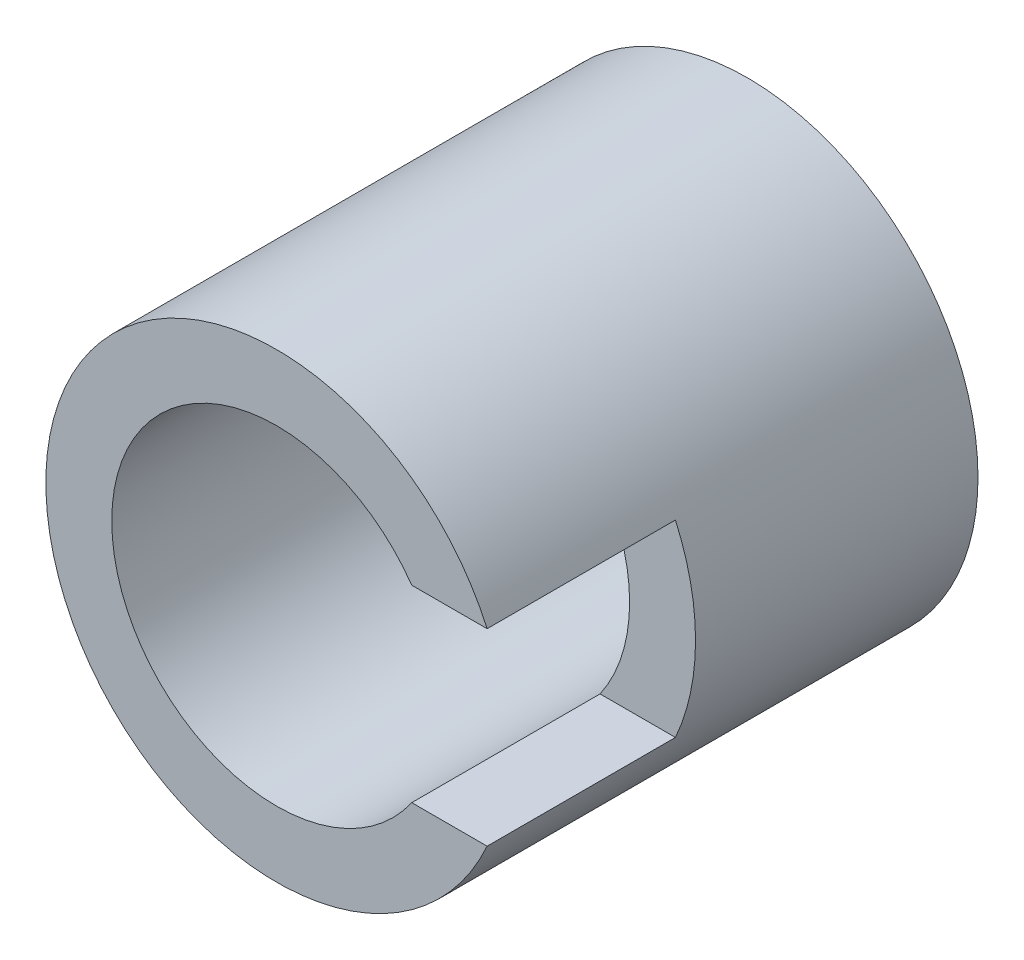
from build123d import *

# Parameters (mm, degrees)
SKETCH_1_R          = 4.9
SKETCH_1_R_2        = 3.5
EXTRUDE_1_DEPTH     = 10
SKETCH_2_W          = 7.078995433
SKETCH_2_H          = 4
CUT_EXTRUDE_1_DEPTH = 4


with BuildPart() as part:
    # 草图1 → 凸台-拉伸1 (new body)
    with BuildSketch(Plane.XY):
        Circle(SKETCH_1_R)
        Circle(SKETCH_1_R_2, mode=Mode.SUBTRACT)
    extrude(amount=EXTRUDE_1_DEPTH)

    # 草图2 → 切除-拉伸1 (cut)
    with BuildSketch(Plane.XY.offset(10)):
        with Locations((2.623845047, 0)):
            Rectangle(SKETCH_2_W, SKETCH_2_H)
    extrude(amount=-CUT_EXTRUDE_1_DEPTH, mode=Mode.SUBTRACT)


solid = part.part
